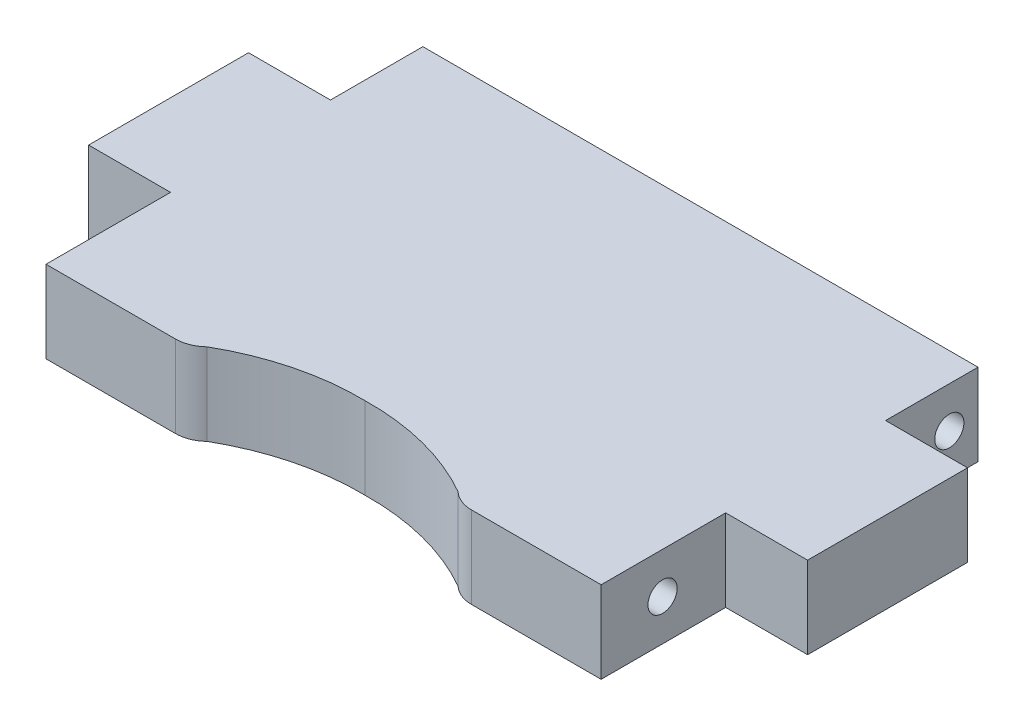
from build123d import *

# Parameters (mm, degrees)
BOSS_EXTRUDE1_DEPTH = 6.35
SKETCH2_R           = 1.1303
CUT_EXTRUDE1_DEPTH  = 12.7
FILLET1_R           = 2.54


with BuildPart() as part:
    # Sketch1 → Boss-Extrude1 (new body)
    with BuildSketch(Plane(origin=(0, 0, 0), x_dir=(1, 0, 0), z_dir=(0, 1, 0))):
        with BuildLine():
            Line((-21.5138, -15.875), (-9.729950234, -15.875))
            Line((-9.729950234, -15.875), (-9.729950234, -15.176835913))
            ThreePointArc((-9.729950234, -15.176835913), (-5.035098569, -13.262737362), (0, -12.668441286))
            ThreePointArc((0, -12.668441286), (5.035098569, -13.262737362), (9.729950234, -15.176835913))
            Line((9.729950234, -15.176835913), (9.729950234, -15.875))
            Line((9.729950234, -15.875), (21.5138, -15.875))
            Line((21.5138, -15.875), (21.5138, -6.223))
            Line((21.5138, -6.223), (27.8638, -6.223))
            Line((27.8638, -6.223), (27.8638, 6.1722))
            Line((27.8638, 6.1722), (21.5138, 6.1722))
            Line((21.5138, 6.1722), (21.5138, 13.335))
            Line((21.5138, 13.335), (-21.5138, 13.335))
            Line((-21.5138, 13.335), (-21.5138, 6.1722))
            Line((-21.5138, 6.1722), (-27.8638, 6.1722))
            Line((-27.8638, 6.1722), (-27.8638, -6.223))
            Line((-27.8638, -6.223), (-21.5138, -6.223))
            Line((-21.5138, -6.223), (-21.5138, -15.875))
        make_face()
    extrude(amount=BOSS_EXTRUDE1_DEPTH)

    # Sketch2 → Cut-Extrude1 (cut)
    with BuildSketch(Plane.ZY.offset(21.5138)):
        with Locations((-11.1125, 3.175)):
            Circle(SKETCH2_R)
        with Locations(Location((11.1125, 3.175, 0), (0, 0, 180))):
            Circle(SKETCH2_R)
    cut_extrude1 = extrude(amount=-CUT_EXTRUDE1_DEPTH, mode=Mode.SUBTRACT)

    # Mirror1: Cut-Extrude1 across plane
    add(cut_extrude1.mirror(Plane(origin=(0, 0, 0), x_dir=(0, 0, 1), z_dir=(1, 0, 0))), mode=Mode.SUBTRACT)

    # Fillet1
    # the kernel refuses this fillet: 2.54 mm, written as the material it takes off along each edge
    with BuildSketch(Plane(origin=(9.729950234, -4.372671145, 15.875), x_dir=(0, 0, -1), z_dir=(0, 1, 0))) as fillet1_piece_1:
        with BuildLine():
            CenterArc((2.54, -1.749068458), FILLET1_R, 136.479850512, 43.520149488)
            Line((0, -1.749068458), (-0.0508, -1.749068458))
            Line((-0.0508, -1.749068458), (-0.0508, 0))
            Line((-0.0508, 0), (0, 0.0508))
            ThreePointArc((0, 0.0508), (0.349082044, 0.0508), (0.661327369, 0.034981369))
            Line((0.661327369, 0.034981369), (0.698164087, 0))
        make_face()
    extrude(amount=15.095342289, mode=Mode.SUBTRACT)
    with BuildSketch(Plane(origin=(-9.729950234, -4.372671145, 15.875), x_dir=(-1, 0, 0), z_dir=(0, 1, 0))) as fillet1_piece_2:
        with BuildLine():
            CenterArc((1.749068458, -2.54), FILLET1_R, 90, 43.520149488)
            Line((0, -0.698164087), (-0.034981369, -0.661327369))
            ThreePointArc((-0.034981369, -0.661327369), (-0.0508, -0.349082044), (-0.0508, 0))
            Line((-0.0508, 0), (0, 0.0508))
            Line((0, 0.0508), (1.749068458, 0.0508))
            Line((1.749068458, 0.0508), (1.749068458, 0))
        make_face()
    extrude(amount=15.095342289, mode=Mode.SUBTRACT)


solid = part.part
